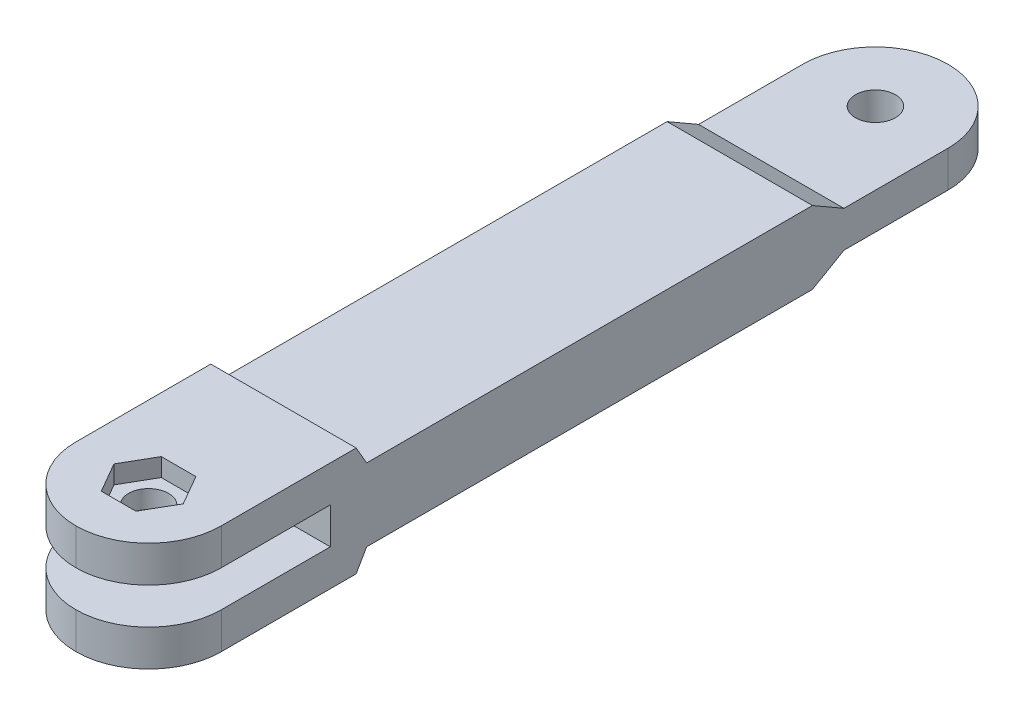
from build123d import *

# Parameters (mm, degrees)
BOSS_EXTRUDE1_DEPTH      = 37.5
BOSS_EXTRUDE1_DEPTH_BACK = 37.5
SKETCH1_W                = 20
SKETCH1_H                = 10
SKETCH3_W                = 20
SKETCH3_H                = 5
BOSS_EXTRUDE2_DEPTH      = 20
FILLET1_R                = 10
SKETCH5_W                = 20
SKETCH5_H                = 5
BOSS_EXTRUDE3_DEPTH      = 25
CHAMFER1_SIZE            = 5
CHAMFER1_SIZE_2          = 8.660254038
FILLET2_R                = 10
CUT_EXTRUDE1_DEPTH       = 65.08002809
CUT_EXTRUDE1_DEPTH_BACK  = 65.08002809
SKETCH4_R                = 2.75
CUT_EXTRUDE2_DEPTH       = 66.048059156
CUT_EXTRUDE2_DEPTH_BACK  = 2.5


# Some blends are built 0.0001 mm under size
with BuildPart() as part:
    # Sketch1 → Boss-Extrude1 (new, two sides: drawn at the far end of the back side and taken through both)
    with BuildSketch(Plane.XY.offset(-BOSS_EXTRUDE1_DEPTH_BACK)):
        Rectangle(SKETCH1_W, SKETCH1_H)
    extrude(amount=BOSS_EXTRUDE1_DEPTH + BOSS_EXTRUDE1_DEPTH_BACK)

    # Sketch3 → Boss-Extrude2 (add)
    with BuildSketch(Plane(origin=(0, 0, -37.5), x_dir=(-1, 0, 0), z_dir=(0, 0, -1))):
        Rectangle(SKETCH3_W, SKETCH3_H)
    extrude(amount=BOSS_EXTRUDE2_DEPTH)

    # Fillet1
    fillet1_edges = [part.edges().sort_by_distance(p)[0] for p in [
        (-10, 0, -57.5),
        (10, 0, -57.5),
    ]]
    fillet(fillet1_edges, radius=FILLET1_R - 0.0001)  # a hair under: the kernel refuses the full size

    # Sketch5 → Boss-Extrude3 (add)
    with BuildSketch(Plane.XY.offset(37.5)):
        with Locations((0, 5)):
            Rectangle(SKETCH5_W, SKETCH5_H)
        with Locations((0, -5)):
            Rectangle(SKETCH5_W, SKETCH5_H)
    extrude(amount=BOSS_EXTRUDE3_DEPTH)

    # Chamfer1
    # the kernel refuses this chamfer: 8.660254038, 5 mm, written as the material it adds along each edge
    with BuildSketch(Plane(origin=(10, 5, 37.5), x_dir=(0, -0.05789386240267149, -0.9983227437537926), z_dir=(-1, 0, 0))) as chamfer1_piece_1_section:
        Polygon((CHAMFER1_SIZE * 0.998322743754, -CHAMFER1_SIZE * 0.0578938624027), (-CHAMFER1_SIZE_2 * 0.0578938624016, -CHAMFER1_SIZE_2 * 0.998322743736), (0, 0), align=None)
    chamfer1_piece_1 = extrude(amount=20, mode=Mode.PRIVATE)
    chamfer1_piece_1 = split(chamfer1_piece_1, bisect_by=Plane(origin=(0, 7.5, 35.327003025), z_dir=(0, -1, 0)), keep=Keep.TOP, mode=Mode.PRIVATE)
    add(chamfer1_piece_1)
    with BuildSketch(Plane(origin=(-10, -5, 37.5), x_dir=(0, 0.05789386240267149, -0.9983227437537926), z_dir=(1, 0, 0))) as chamfer1_piece_2_section:
        Polygon((CHAMFER1_SIZE * 0.998322743754, -CHAMFER1_SIZE * 0.0578938624027), (-CHAMFER1_SIZE_2 * 0.0578938624016, -CHAMFER1_SIZE_2 * 0.998322743736), (0, 0), align=None)
    chamfer1_piece_2 = extrude(amount=20, mode=Mode.PRIVATE)
    chamfer1_piece_2 = split(chamfer1_piece_2, bisect_by=Plane(origin=(0, -7.5, 35.327003025), z_dir=(0, 1, 0)), keep=Keep.TOP, mode=Mode.PRIVATE)
    add(chamfer1_piece_2)
    # the kernel refuses this chamfer: 8.660254038, 5 mm, written as the material it takes off along each edge
    with BuildSketch(Plane(origin=(32.404819853, 5, -37.5), x_dir=(0, 0.019326765612700598, 0.9998132206222078), z_dir=(-1, 0, 0))) as chamfer1_2_piece_1_section:
        Polygon((CHAMFER1_SIZE_2 * 0.999813220604, -CHAMFER1_SIZE_2 * 0.0193267656124), (-CHAMFER1_SIZE * 0.0193267656127, -CHAMFER1_SIZE * 0.999813220622), (0, 0), align=None)
    chamfer1_2_piece_1 = extrude(amount=64.809639706, mode=Mode.PRIVATE)
    chamfer1_2_piece_1 = split(chamfer1_2_piece_1, bisect_by=Plane(origin=(0, 2.5, -34.039331058), z_dir=(0, 1, 0)), keep=Keep.TOP, mode=Mode.PRIVATE)
    add(chamfer1_2_piece_1, mode=Mode.SUBTRACT)
    with BuildSketch(Plane(origin=(-32.404819853, -5, -37.5), x_dir=(0, 0.9983227437537926, -0.057893862402671824), z_dir=(1, 0, 0))) as chamfer1_2_piece_2_section:
        Polygon((CHAMFER1_SIZE * 0.998322743754, CHAMFER1_SIZE * 0.0578938624027), (-CHAMFER1_SIZE_2 * 0.0578938624016, CHAMFER1_SIZE_2 * 0.998322743736), (0, 0), align=None)
    chamfer1_2_piece_2 = extrude(amount=64.809639706, mode=Mode.PRIVATE)
    chamfer1_2_piece_2 = split(chamfer1_2_piece_2, bisect_by=Plane(origin=(0, -2.5, -34.039331058), z_dir=(0, -1, 0)), keep=Keep.TOP, mode=Mode.PRIVATE)
    add(chamfer1_2_piece_2, mode=Mode.SUBTRACT)

    # Fillet2
    fillet2_edges = [part.edges().sort_by_distance(p)[0] for p in [
        (-10, -5, 62.5),
        (-10, 5, 62.5),
        (10, -5, 62.5),
        (10, 5, 62.5),
    ]]
    fillet(fillet2_edges, radius=FILLET2_R - 0.0001)  # a hair under: the kernel refuses the full size

    # Sketch4 → Cut-Extrude1 (cut, two sides: drawn at the far end of the back side and taken through both)
    with BuildSketch(Plane(origin=(0, 2.5, 0), x_dir=(1, 0, 0), z_dir=(0, 1, 0)).offset(-CUT_EXTRUDE1_DEPTH_BACK)):
        with Locations(Location((0, 47.5, 0), (0, 0, 270))):
            Circle(SKETCH4_R)
        with Locations(Location((0, -52.5, 0), (0, 0, 270))):
            Circle(SKETCH4_R)
    extrude(amount=CUT_EXTRUDE1_DEPTH + CUT_EXTRUDE1_DEPTH_BACK, mode=Mode.SUBTRACT)

    # Sketch6 → Cut-Extrude2 (cut, two sides: drawn at the far end of the back side and taken through both)
    with BuildSketch(Plane(origin=(0, 7.5, 0), x_dir=(1, 0, 0), z_dir=(0, 1, 0)).offset(-CUT_EXTRUDE2_DEPTH_BACK)):
        Polygon((-2.38156986, -48.375), (-4.763139721, -52.5), (-2.38156986, -56.625), (2.38156986, -56.625), (4.763139721, -52.5), (2.38156986, -48.375), align=None)
    extrude(amount=CUT_EXTRUDE2_DEPTH + CUT_EXTRUDE2_DEPTH_BACK, mode=Mode.SUBTRACT)


solid = part.part
